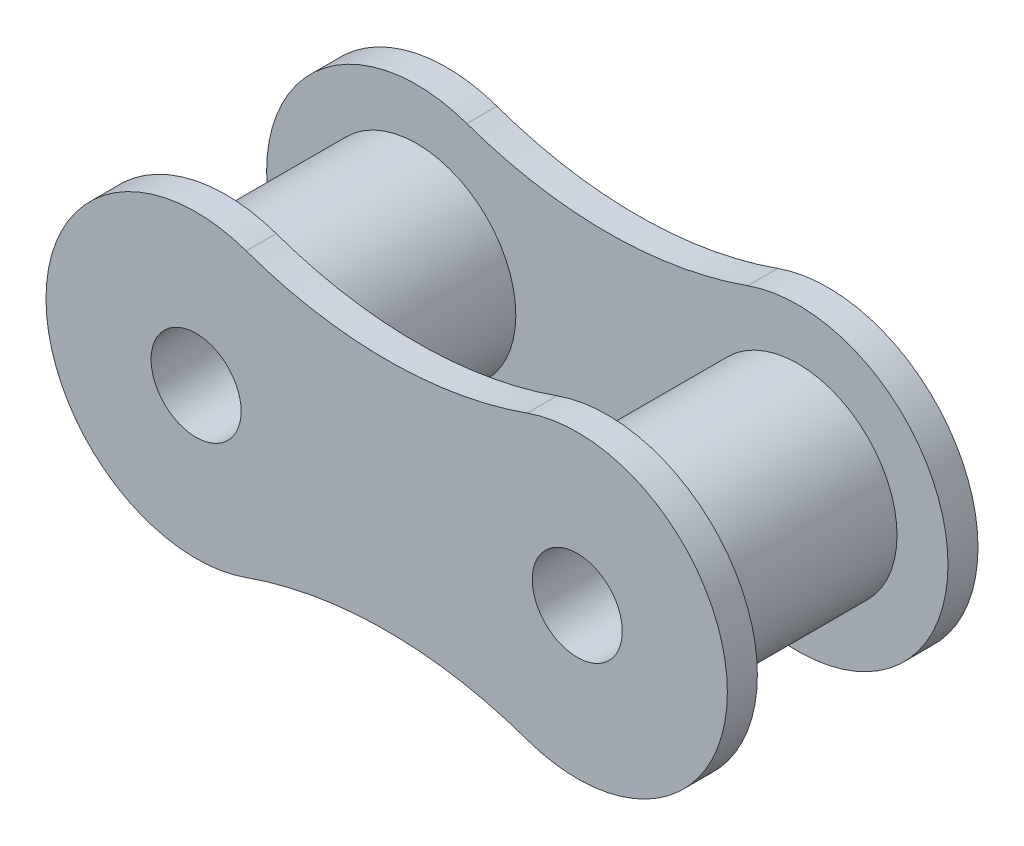
from build123d import *

# Parameters (mm, degrees)
SKETCH1_R           = 0.75
BOSS_EXTRUDE1_DEPTH = 0.5
SKETCH2_R           = 1.651
SKETCH2_R_2         = 0.75
BOSS_EXTRUDE2_DEPTH = 3.175


with BuildPart() as part:
    # Sketch1 → Boss-Extrude1 (new body)
    with BuildSketch(Plane.XY):
        with BuildLine():
            ThreePointArc((0.835526316, 2.356246119), (-2.5, 0), (0.835526316, -2.356246119))
            ThreePointArc((0.835526316, -2.356246119), (3.175, -1.953735254), (5.514473684, -2.356246119))
            ThreePointArc((5.514473684, -2.356246119), (8.85, 0), (5.514473684, 2.356246119))
            ThreePointArc((5.514473684, 2.356246119), (3.175, 1.953735254), (0.835526316, 2.356246119))
        make_face()
        Circle(SKETCH1_R, mode=Mode.SUBTRACT)
        with Locations((6.35, 0)):
            Circle(SKETCH1_R, mode=Mode.SUBTRACT)
    extrude(amount=BOSS_EXTRUDE1_DEPTH)

    # Sketch2 → Boss-Extrude2 (add)
    # profile 1 of 2: a face of its own
    with BuildSketch(Plane.XY.offset(0.5)):
        Circle(SKETCH2_R)
        Circle(SKETCH2_R_2, mode=Mode.SUBTRACT)
    # profile 2 of 2: a face of its own
    with BuildSketch(Plane.XY.offset(0.5)):
        with Locations((6.35, 0)):
            Circle(SKETCH2_R)
        with Locations((6.35, 0)):
            Circle(SKETCH2_R_2, mode=Mode.SUBTRACT)
    extrude(amount=BOSS_EXTRUDE2_DEPTH)

    # Mirror1: part across plane


with BuildPart() as part_1:
    add(part.part)
    add(part.part.mirror(Plane.XY.offset(2.0875)))


solid = part_1.part
